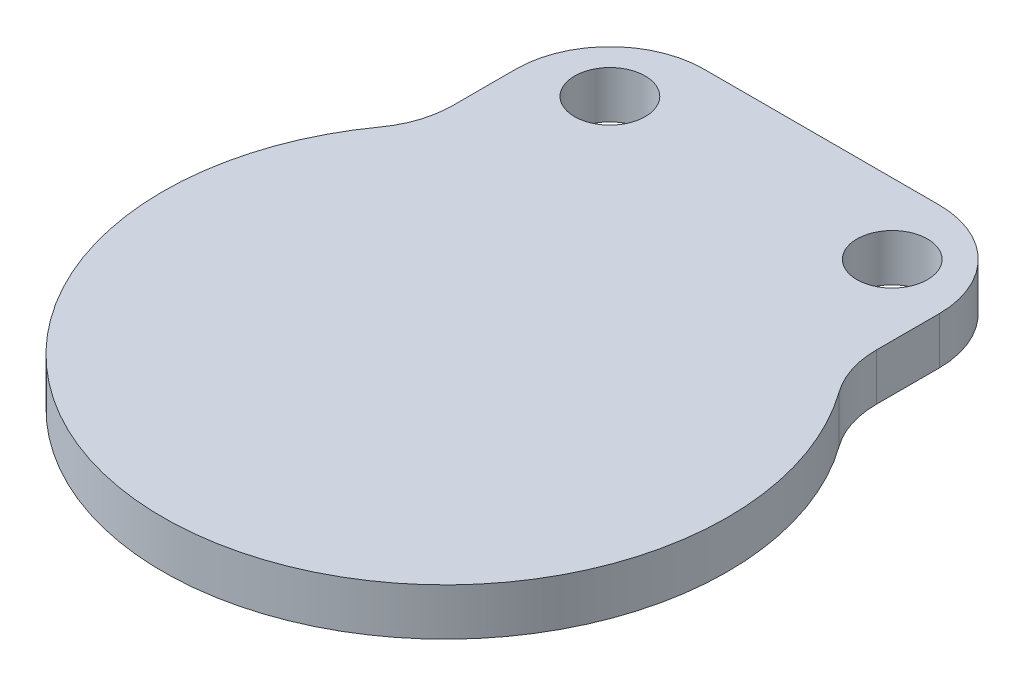
from build123d import *

# Parameters (mm, degrees)
SKETCH1_R           = 1.5
BOSS_EXTRUDE1_DEPTH = 2
FILLET2_R           = 4


with BuildPart() as part:
    # Sketch1 → Boss-Extrude1 (new body)
    with BuildSketch(Plane(origin=(0, 0, 0), x_dir=(1, 0, 0), z_dir=(0, 1, 0))):
        with BuildLine():
            Line((-9, 10), (-9, 7.937253933))
            ThreePointArc((-9, 7.937253933), (0, -12), (9, 7.937253933))
            Line((9, 7.937253933), (9, 10))
            Line((9, 10), (9, 16))
            Line((9, 16), (-9, 16))
            Line((-9, 16), (-9, 10))
        make_face()
        with Locations((-6, 13)):
            Circle(SKETCH1_R, mode=Mode.SUBTRACT)
        with Locations((6, 13)):
            Circle(SKETCH1_R, mode=Mode.SUBTRACT)
    extrude(amount=BOSS_EXTRUDE1_DEPTH)

    # Fillet2
    fillet2_edges = [part.edges().sort_by_distance(p)[0] for p in [
        (-9, 1, -7.937253933),
        (-9, 1, -16),
        (9, 1, -16),
        (9, 1, -7.937253933),
    ]]
    fillet(fillet2_edges, radius=FILLET2_R)


solid = part.part
